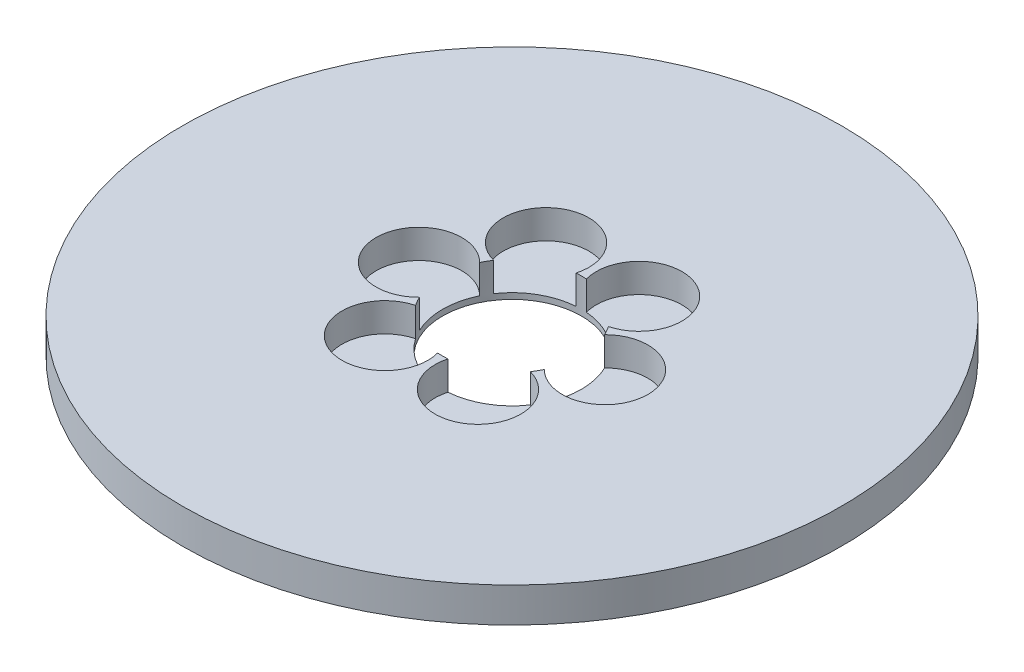
from build123d import *

# Parameters (mm, degrees)
SKETCH1_R           = 47.5
BOSS_EXTRUDE1_DEPTH = 5
SKETCH2_R           = 10
CUT_EXTRUDE1_DEPTH  = 68.360967927
SKETCH3_R           = 6.183308578
CUT_EXTRUDE2_DEPTH  = 4.15585977
CIRPATTERN1_COUNT   = 6


with BuildPart() as part:
    # Sketch1 → Boss-Extrude1 (new body)
    with BuildSketch(Plane(origin=(0, 0, 0), x_dir=(1, 0, 0), z_dir=(0, 1, 0))):
        Circle(SKETCH1_R)
    extrude(amount=BOSS_EXTRUDE1_DEPTH)

    # Sketch2 → Cut-Extrude1 (cut, through all)
    with BuildSketch(Plane(origin=(0, 0, 0), x_dir=(1, 0, 0), z_dir=(0, 1, 0))):
        Circle(SKETCH2_R)
    extrude(amount=CUT_EXTRUDE1_DEPTH, mode=Mode.SUBTRACT)

    # Sketch3 → Cut-Extrude2 (cut)
    with BuildSketch(Plane(origin=(0, 5, 0), x_dir=(1, 0, 0), z_dir=(0, 1, 0))):
        with Locations((-13.410140289, 0)):
            Circle(SKETCH3_R)
    cut_extrude2 = extrude(amount=-CUT_EXTRUDE2_DEPTH, mode=Mode.SUBTRACT)

    # CirPattern1: Cut-Extrude2 ×6 about axis
    cirpattern1_axis = Axis((0, 0, 0), (0, 1, 0))
    for i in range(1, CIRPATTERN1_COUNT):
        add(cut_extrude2.rotate(cirpattern1_axis, i * 360 / CIRPATTERN1_COUNT), mode=Mode.SUBTRACT)


solid = part.part
